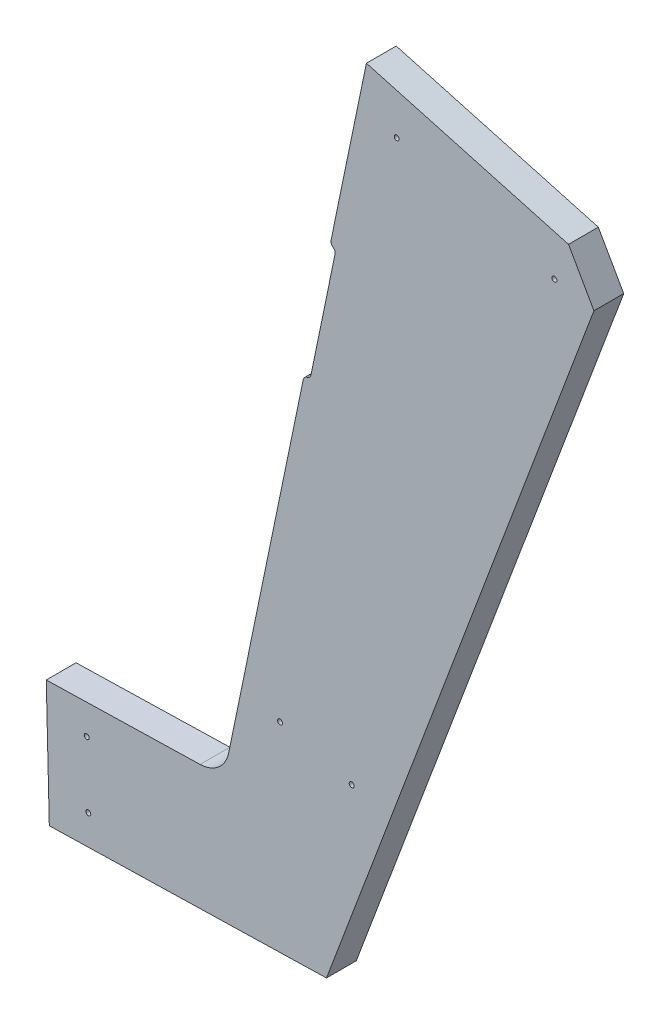
from build123d import *

# Parameters (mm, degrees)
BOSS_EXTRUDE1_DEPTH                  = 19.05
HOLE2_D                              = 3.175
HOLE2_DEPTH                          = 39.686133767
HOLE2_CSINK_D                        = 10.16
HOLE2_CSINK_ANGLE                    = 82
HOLE2_TIP                            = 0.953866233
SKETCH6_W                            = 19.05
SKETCH6_H                            = 82.55
CUT_EXTRUDE1_DEPTH                   = 3.81
FILLET1_R                            = 3.175
FILLET2_R                            = 3.175
F_15_64_0_23438_DIAMETER_HOLE1_D     = 5.953252
F_15_64_0_23438_DIAMETER_HOLE1_DEPTH = 15.875
F_15_64_0_23438_DIAMETER_HOLE1_TIP   = 1.788537341


with BuildPart() as part:
    # Sketch1 → Boss-Extrude1 (new body)
    with BuildSketch(Plane.XY):
        with BuildLine():
            Line((-61.753066592, -505.133747826), (-59.805322331, -584.903623222))
            Line((-59.805322331, -584.903623222), (117.387139244, -580.57710775))
            Line((117.387139244, -580.57710775), (288.394610743, -125.650072018))
            Line((288.394610743, -125.650072018), (272.141590142, -96.993017293))
            Line((272.141590142, -96.993017293), (142.933900932, -61.306223753))
            Line((142.933900932, -61.306223753), (54.780700044, -487.546357698))
            ThreePointArc((54.780700044, -487.546357698), (48.334106484, -498.311851218), (36.590496304, -502.732489089))
            Line((36.590496304, -502.732489089), (-61.753066592, -505.133747826))
        make_face()
    extrude(amount=BOSS_EXTRUDE1_DEPTH)

    # Hole2
    with Locations(Plane(origin=(295.820901284, -105.894091108, -19.05), x_dir=(-0.3518626346959965, -0.9360516472421764, 8.51430303154421e-15), z_dir=(0, 0, -1))):
        with Locations((546.331381686, 147.924742102), (34.861843518, 129.510688231), (398.711186007, 72.427013068), (25.409302346, 25.4), (393.709302346, 25.4), (604.536477781, 403.287242286), (643.194157759, 387.668525745), (520.756836983, 195.925354764), (559.414516961, 180.306638222), (507.673701708, 163.543458643)):
            CounterSinkHole(HOLE2_D / 2, HOLE2_CSINK_D / 2, depth=HOLE2_DEPTH, counter_sink_angle=HOLE2_CSINK_ANGLE)
            with Locations((0, 0, -(HOLE2_DEPTH + HOLE2_TIP / 2))):  # 118° drill point
                Cone(0, HOLE2_D / 2, HOLE2_TIP, mode=Mode.SUBTRACT)

    # Sketch6 → Cut-Extrude1 (cut)
    with BuildSketch(Plane(origin=(149.230014772, -30.863127198, 0), x_dir=(0, 0, 1), z_dir=(-0.9792761029762531, 0.20252978580851497, 0))):
        with Locations((9.525, -186.662347544)):
            Rectangle(SKETCH6_W, SKETCH6_H)
    extrude(amount=-CUT_EXTRUDE1_DEPTH, mode=Mode.SUBTRACT)

    # Fillet1
    fillet1_edges = [part.edges().sort_by_distance(p)[0] for p in [
        (106.796954548, -254.848363108, 9.525),
        (123.515788367, -174.009120807, 9.525),
    ]]
    fillet(fillet1_edges, radius=FILLET1_R)

    # Fillet2
    fillet2_edges = [part.edges().sort_by_distance(p)[0] for p in [
        (119.784746415, -173.237482323, 9.525),
        (103.065912596, -254.076724624, 9.525),
    ]]
    fillet(fillet2_edges, radius=FILLET2_R)

    # 15/64 (0.23438) Diameter Hole1
    with Locations(Plane(origin=(152.961056724, -31.634765682, 0), x_dir=(0, 0, 1), z_dir=(-0.9792761029762531, 0.20252978580851497, 0))):
        with Locations((9.525, -186.662347544)):
            Hole(F_15_64_0_23438_DIAMETER_HOLE1_D / 2, depth=F_15_64_0_23438_DIAMETER_HOLE1_DEPTH)
            with Locations((0, 0, -(F_15_64_0_23438_DIAMETER_HOLE1_DEPTH + F_15_64_0_23438_DIAMETER_HOLE1_TIP / 2))):  # 118° drill point
                Cone(0, F_15_64_0_23438_DIAMETER_HOLE1_D / 2, F_15_64_0_23438_DIAMETER_HOLE1_TIP, mode=Mode.SUBTRACT)


solid = part.part
